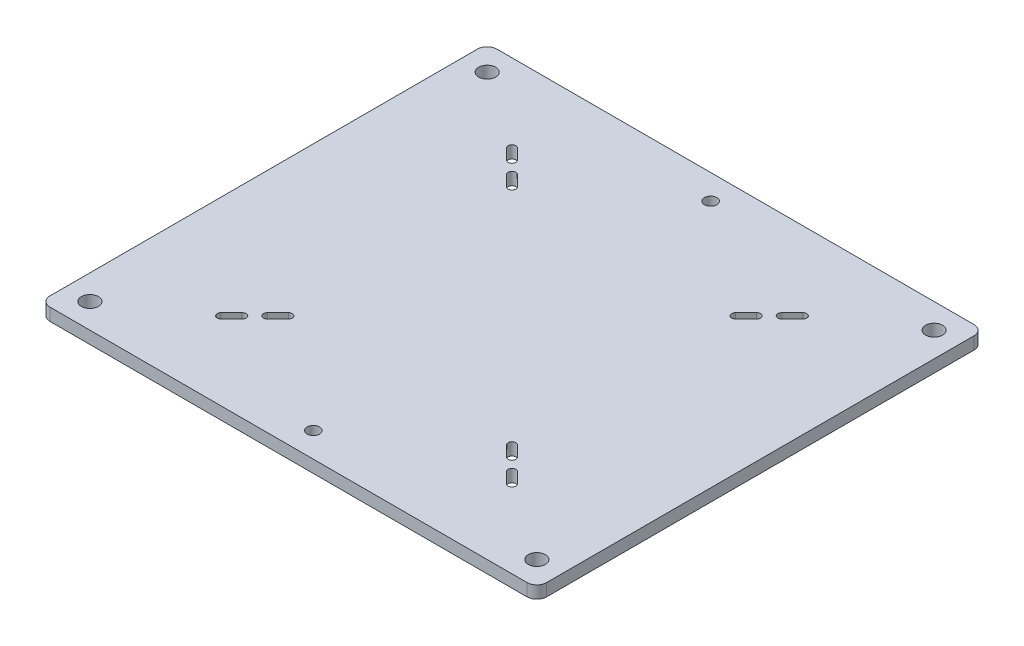
from build123d import *

# Parameters (mm, degrees)
SKETCH1_W                            = 254
SKETCH1_H                            = 228.6
BASE_PLATE_DEPTH                     = 6.35
SLOTS_DEPTH                          = 342.781044676
FEET_CONNECTION_HOLE_D               = 8.7376
HOLE_FOR_10_BLIND_FASTENERS_B_BS_1_D = 6.35
FILLET1_R                            = 5


with BuildPart() as part:
    # Sketch1 → base plate (new body)
    with BuildSketch(Plane(origin=(0, 0, 0), x_dir=(1, 0, 0), z_dir=(0, 1, 0))):
        with Locations((127, -114.3)):
            Rectangle(SKETCH1_W, SKETCH1_H)
    extrude(amount=-BASE_PLATE_DEPTH)

    # Sketch3 → slots (cut, through all)
    with BuildSketch(Plane(origin=(0, 0, 0), x_dir=(1, 0, 0), z_dir=(0, 1, 0))):
        with BuildLine():
            Line((56.592898159, -181.878674626), (51.204744487, -187.266828298))
            ThreePointArc((51.204744487, -187.266828298), (51.204744487, -190.095255513), (54.033171702, -190.095255513))
            Line((54.033171702, -190.095255513), (59.421325374, -184.707101841))
            ThreePointArc((59.421325374, -184.707101841), (59.421325374, -181.878674626), (56.592898159, -181.878674626))
        make_face()
        with BuildLine():
            Line((65.841855038, -178.286572177), (71.230008711, -172.898418504))
            ThreePointArc((71.230008711, -172.898418504), (71.230008711, -170.069991289), (68.401581496, -170.069991289))
            Line((68.401581496, -170.069991289), (63.013427823, -175.458144962))
            ThreePointArc((63.013427823, -175.458144962), (63.013427823, -178.286572177), (65.841855038, -178.286572177))
        make_face()
        with BuildLine():
            ThreePointArc((54.033171702, -38.504744487), (51.204744487, -38.504744487), (51.204744487, -41.333171702))
            Line((51.204744487, -41.333171702), (56.592898159, -46.721325374))
            ThreePointArc((56.592898159, -46.721325374), (59.421325374, -46.721325374), (59.421325374, -43.892898159))
            Line((59.421325374, -43.892898159), (54.033171702, -38.504744487))
        make_face()
        with BuildLine():
            ThreePointArc((68.401581496, -58.530008711), (71.230008711, -58.530008711), (71.230008711, -55.701581496))
            Line((71.230008711, -55.701581496), (65.841855038, -50.313427823))
            ThreePointArc((65.841855038, -50.313427823), (63.013427823, -50.313427823), (63.013427823, -53.141855038))
            Line((63.013427823, -53.141855038), (68.401581496, -58.530008711))
        make_face()
        with BuildLine():
            Line((197.407101841, -46.721325374), (202.795255513, -41.333171702))
            ThreePointArc((202.795255513, -41.333171702), (202.795255513, -38.504744487), (199.966828298, -38.504744487))
            Line((199.966828298, -38.504744487), (194.578674626, -43.892898159))
            ThreePointArc((194.578674626, -43.892898159), (194.578674626, -46.721325374), (197.407101841, -46.721325374))
        make_face()
        with BuildLine():
            Line((188.158144962, -50.313427823), (182.769991289, -55.701581496))
            ThreePointArc((182.769991289, -55.701581496), (182.769991289, -58.530008711), (185.598418504, -58.530008711))
            Line((185.598418504, -58.530008711), (190.986572177, -53.141855038))
            ThreePointArc((190.986572177, -53.141855038), (190.986572177, -50.313427823), (188.158144962, -50.313427823))
        make_face()
        with BuildLine():
            ThreePointArc((185.598418504, -170.069991289), (182.769991289, -170.069991289), (182.769991289, -172.898418504))
            Line((182.769991289, -172.898418504), (188.158144962, -178.286572177))
            ThreePointArc((188.158144962, -178.286572177), (190.986572177, -178.286572177), (190.986572177, -175.458144962))
            Line((190.986572177, -175.458144962), (185.598418504, -170.069991289))
        make_face()
        with BuildLine():
            ThreePointArc((199.966828298, -190.095255513), (202.795255513, -190.095255513), (202.795255513, -187.266828298))
            Line((202.795255513, -187.266828298), (197.407101841, -181.878674626))
            ThreePointArc((197.407101841, -181.878674626), (194.578674626, -181.878674626), (194.578674626, -184.707101841))
            Line((194.578674626, -184.707101841), (199.966828298, -190.095255513))
        make_face()
    extrude(amount=-SLOTS_DEPTH, mode=Mode.SUBTRACT)

    # Feet connection hole (through all)
    with Locations(Plane(origin=(0, 0, 0), x_dir=(1, 0, 0), z_dir=(0, 1, 0))):
        with Locations((12.7, -215.9), (241.3, -12.7), (12.7, -12.7), (241.3, -215.9)):
            Hole(FEET_CONNECTION_HOLE_D / 2)

    # Hole for #10 Blind Fasteners (B,BS)1 (through all)
    with Locations(Plane(origin=(0, 0, 0), x_dir=(1, 0, 0), z_dir=(0, 1, 0))):
        with Locations((127, -215.9), (127, -12.7)):
            Hole(HOLE_FOR_10_BLIND_FASTENERS_B_BS_1_D / 2)

    # Fillet1
    fillet1_edges = [part.edges().sort_by_distance(p)[0] for p in [
        (0, -3.175, 0),
        (0, -3.175, 228.6),
        (254, -3.175, 228.6),
        (254, -3.175, 0),
    ]]
    fillet(fillet1_edges, radius=FILLET1_R)


solid = part.part
